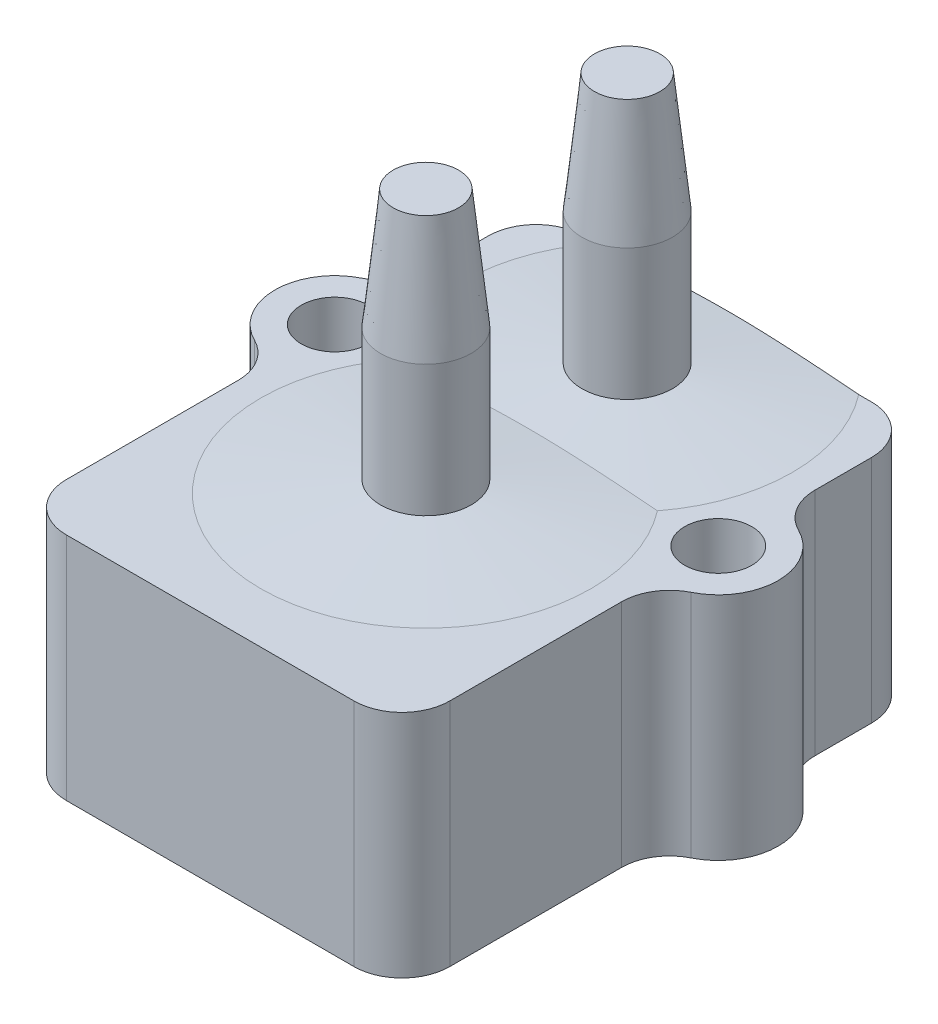
from build123d import *

# Parameters (mm, degrees)
SKETCH1_R           = 1.778
BOSS_EXTRUDE1_DEPTH = 6.096
FILLET1_R           = 2.54
SKETCH2_R           = 2.4003
BOSS_EXTRUDE2_DEPTH = 13.97
CHAMFER1_SIZE       = 6.35
CHAMFER1_SIZE_2     = 0.667411894


with BuildPart() as part:
    # Sketch1 → Boss-Extrude1 (new, symmetric)
    with BuildSketch(Plane(origin=(0, 0, 0), x_dir=(1, 0, 0), z_dir=(0, 1, 0))):
        with BuildLine():
            Line((-10.16, 6.223), (-10.16, 13.716))
            Line((-10.16, 13.716), (10.16, 13.716))
            Line((10.16, 13.716), (10.16, 6.223))
            ThreePointArc((10.16, 6.223), (13.335, 3.048), (10.16, -0.127))
            Line((10.16, -0.127), (10.16, -13.716))
            Line((10.16, -13.716), (-10.16, -13.716))
            Line((-10.16, -13.716), (-10.16, -0.127))
            ThreePointArc((-10.16, -0.127), (-13.335, 3.048), (-10.16, 6.223))
        make_face()
        with Locations(Location((-10.16, 3.048, 0), (0, 0, 90))):
            Circle(SKETCH1_R, mode=Mode.SUBTRACT)
        with Locations(Location((10.16, 3.048, 0), (0, 0, 90))):
            Circle(SKETCH1_R, mode=Mode.SUBTRACT)
    extrude(amount=BOSS_EXTRUDE1_DEPTH, both=True)

    # Fillet1
    fillet1_edges = [part.edges().sort_by_distance(p)[0] for p in [
        (10.16, 0, -6.223),
        (10.16, 0, 0.127),
        (10.16, 0, 13.716),
        (-10.16, 0, 13.716),
        (-10.16, 0, 0.127),
        (-10.16, 0, -6.223),
        (-10.16, 0, -13.716),
        (10.16, 0, -13.716),
    ]]
    fillet(fillet1_edges, radius=FILLET1_R)

    # Sketch2 → Boss-Extrude2 (add)
    with BuildSketch(Plane(origin=(0, 6.096, 0), x_dir=(1, 0, 0), z_dir=(0, 1, 0))):
        with Locations(Location((0, 8.382, 0), (0, 0, 270))):
            Circle(SKETCH2_R)
        with Locations(Location((0, -2.286, 0), (0, 0, 270))):
            Circle(SKETCH2_R)
    extrude(amount=BOSS_EXTRUDE2_DEPTH)

    # Chamfer1
    # the kernel refuses this chamfer: 6.35, 0.667411894 mm, written as the material it adds along each edge
    with BuildSketch(Plane(origin=(0, 6.096, -8.382), x_dir=(0, 0, 1), z_dir=(-1, 0, 0))) as chamfer1_piece_1_section:
        Polygon((2.4003 + CHAMFER1_SIZE, 0), (2.4003, CHAMFER1_SIZE_2), (2.4003, 0), align=None)
    chamfer1_piece_1 = revolve(axis=Axis((0, 6.096, -8.382), (0, 1, 0)), mode=Mode.PRIVATE)
    chamfer1_piece_1 = split(chamfer1_piece_1, bisect_by=Plane(origin=(6.803322578, 6.146034246, -13.716), z_dir=(0, 0, 1)), keep=Keep.TOP, mode=Mode.PRIVATE)
    add(chamfer1_piece_1)
    with BuildSketch(Plane(origin=(0, 6.096, 2.286), x_dir=(0, 0, 1), z_dir=(-1, 0, 0))) as chamfer1_piece_2:
        Polygon((2.4003 + CHAMFER1_SIZE, 0), (2.4003, CHAMFER1_SIZE_2), (2.4003, 0), align=None)
    revolve(axis=Axis((0, 6.096, 2.286), (0, 1, 0)))
    # the kernel refuses this chamfer: 6.35, 0.667411894 mm, written as the material it takes off along each edge
    with BuildSketch(Plane(origin=(0, 20.066, -8.382), x_dir=(0, 0, 1), z_dir=(-1, 0, 0))) as chamfer1_2_piece_1:
        Polygon((2.4003, -CHAMFER1_SIZE), (2.4003 - CHAMFER1_SIZE_2, 0), (2.4003, 0), align=None)
    revolve(axis=Axis((0, 20.066, -8.382), (0, 1, 0)), mode=Mode.SUBTRACT)
    with BuildSketch(Plane(origin=(0, 20.066, 2.286), x_dir=(0, 0, 1), z_dir=(-1, 0, 0))) as chamfer1_2_piece_2:
        Polygon((2.4003, -CHAMFER1_SIZE), (2.4003 - CHAMFER1_SIZE_2, 0), (2.4003, 0), align=None)
    revolve(axis=Axis((0, 20.066, 2.286), (0, 1, 0)), mode=Mode.SUBTRACT)


solid = part.part
